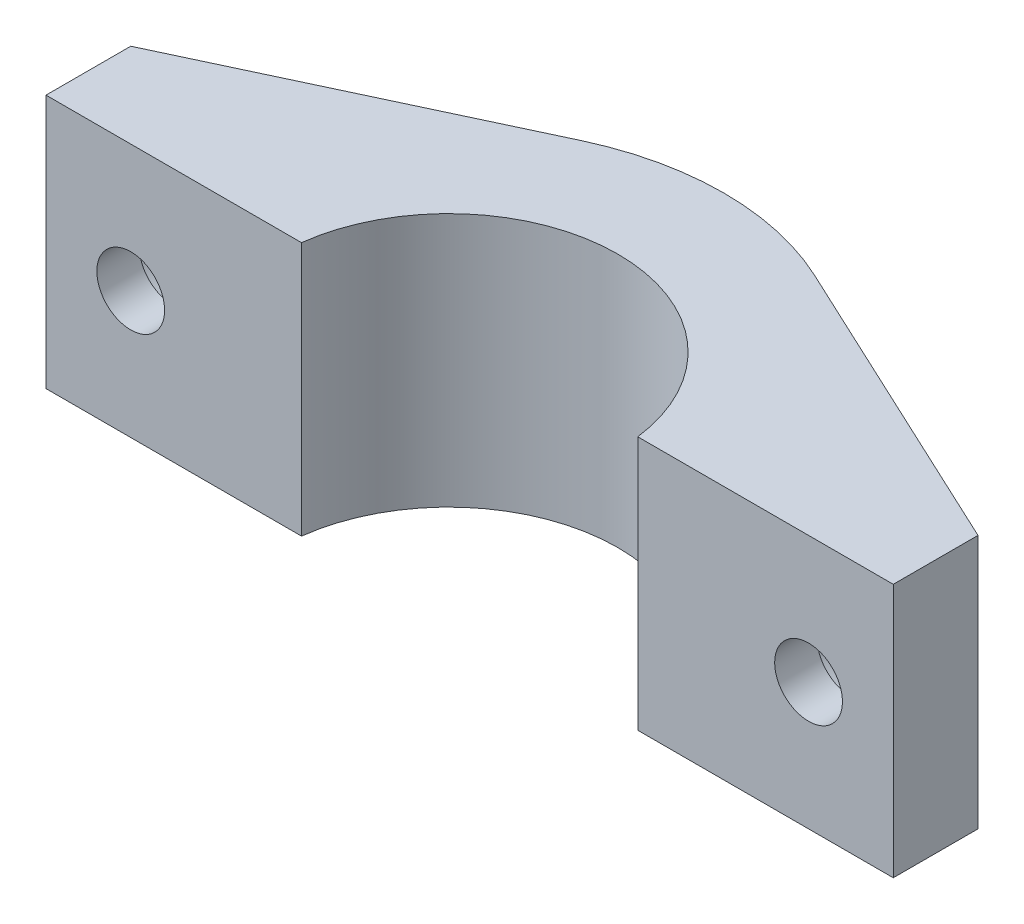
from build123d import *

# Parameters (mm, degrees)
BOSS_EXTRUDE1_DEPTH  = 12
SKETCH2_R            = 1.6
CUT_EXTRUDE1_DEPTH   = 12
SKETCH3_R            = 3
CUT_EXTRUDE2_DEPTH   = 2
BOSS_EXTRUDE2_DEPTH  = 2
MIRROR2_COPY_1_DEPTH = 2
SKETCH5_W            = 40
SKETCH5_H            = 1
CUT_EXTRUDE3_DEPTH   = 20


with BuildPart() as part:
    # Sketch1 → Boss-Extrude1 (new body)
    with BuildSketch(Plane(origin=(0, 0, 0), x_dir=(1, 0, 0), z_dir=(0, 1, 0))):
        with BuildLine():
            Line((13, 0), (20, 0))
            Line((20, 0), (20, 5))
            Line((20, 5), (12, 5))
            ThreePointArc((12, 5), (12.747548784, 2.549509757), (13, 0))
        make_face()
        with BuildLine():
            Line((8, 0), (13, 0))
            ThreePointArc((13, 0), (12.747548784, 2.549509757), (12, 5))
            Line((12, 5), (6.244997998, 5))
            ThreePointArc((6.244997998, 5), (7.548509256, 2.649529771), (8, 0))
        make_face()
        with BuildLine():
            ThreePointArc((-12, 5), (-12.747548784, 2.549509757), (-13, 0))
            Line((-13, 0), (-8, 0))
            ThreePointArc((-8, 0), (-7.548509256, 2.649529771), (-6.244997998, 5))
            Line((-6.244997998, 5), (-12, 5))
        make_face()
        with BuildLine():
            Line((6.244997998, 5), (12, 5))
            ThreePointArc((12, 5), (0, 13), (-12, 5))
            Line((-12, 5), (-6.244997998, 5))
            ThreePointArc((-6.244997998, 5), (0, 8), (6.244997998, 5))
        make_face()
        with BuildLine():
            Line((-20, 0), (-13, 0))
            ThreePointArc((-13, 0), (-12.747548784, 2.549509757), (-12, 5))
            Line((-12, 5), (-20, 5))
            Line((-20, 5), (-20, 0))
        make_face()
    extrude(amount=BOSS_EXTRUDE1_DEPTH)

    # Sketch2 → Cut-Extrude1 (cut)
    with BuildSketch(Plane(origin=(0, 0, -5), x_dir=(-1, 0, 0), z_dir=(0, 0, -1))):
        with Locations((16, 6)):
            Circle(SKETCH2_R)
        with Locations((-16, 6)):
            Circle(SKETCH2_R)
    extrude(amount=-CUT_EXTRUDE1_DEPTH, mode=Mode.SUBTRACT)

    # Sketch3 → Cut-Extrude2 (cut)
    with BuildSketch(Plane(origin=(0, 0, -5), x_dir=(-1, 0, 0), z_dir=(0, 0, -1))):
        with Locations((16, 6)):
            Circle(SKETCH3_R)
        with Locations((-16, 6)):
            Circle(SKETCH3_R)
    extrude(amount=-CUT_EXTRUDE2_DEPTH, mode=Mode.SUBTRACT)

    # Sketch4 → Boss-Extrude2 (add)
    with BuildSketch(Plane(origin=(0, 12, 0), x_dir=(1, 0, 0), z_dir=(0, 1, 0))):
        Polygon((-20, 5), (-5.505882353, 11.776470588), (-3.437353346, 7.352116879), (-12, 5), align=None)
    boss_extrude2 = extrude(amount=-BOSS_EXTRUDE2_DEPTH)

    # Mirror1: Boss-Extrude2 across plane
    add(boss_extrude2.mirror(Plane(origin=(0, 0, 0), x_dir=(0, 0, 1), z_dir=(1, 0, 0))))

    # Mirror2: Boss-Extrude2 across plane
    add(boss_extrude2.mirror(Plane.ZX.offset(6)))

    # Mirror2 copy 1 sketch → Mirror2 copy 1 (add)
    with BuildSketch(Plane(origin=(0, 0, 0), x_dir=(-1, 0, 0), z_dir=(0, -1, 0))):
        Polygon((-20, 5), (-5.505882353, 11.776470588), (-3.437353346, 7.352116879), (-12, 5), align=None)
    extrude(amount=-MIRROR2_COPY_1_DEPTH)

    # Chamfer1
    # the kernel refuses this chamfer: 5 mm, written as the material it adds along each edge
    with BuildSketch(Plane(origin=(-12, 2, -5), x_dir=(0.5282334615554308, 0, -0.8490991756521539), z_dir=(0, 1, 0))) as chamfer1_piece_1_section:
        with BuildLine():
            Line((3.55102746, 0), (-2.413771098, 3.712725473))
            Line((-2.413771098, 3.712725473), (-2.498681015, 3.659902127))
            ThreePointArc((-2.498681015, 3.659902127), (-1.254288539, 1.826872841), (-0.084909918, -0.052823346))
            Line((-0.084909918, -0.052823346), (0.016102351, -0.098695057))
            ThreePointArc((0.016102351, -0.098695057), (1.773886736, 0.065687387), (3.541120329, -0.099508034))
            Line((3.541120329, -0.099508034), (3.55102746, 0))
        make_face()
    chamfer1_piece_1 = extrude(amount=8, mode=Mode.PRIVATE)
    chamfer1_piece_1 = chamfer1_piece_1 - Plane(origin=(-16, 6, -6.086552006), x_dir=(-1, 0, 0), z_dir=(0, 0, -1)) * Cylinder(3, 31, mode=Mode.PRIVATE)
    add(chamfer1_piece_1)
    with BuildSketch(Plane(origin=(12, 2, -5), x_dir=(0.9998009840016291, 0, 0.01994974659924107), z_dir=(0, 1, 0))) as chamfer1_piece_2_section:
        with BuildLine():
            Line((4.428388121, 0), (-1.935550186, 2.977153255))
            Line((-1.935550186, 2.977153255), (-2.013576875, 2.914608585))
            ThreePointArc((-2.013576875, 2.914608585), (-0.911816487, 1.523016637), (-0.091522024, -0.040295399))
            Line((-0.091522024, -0.040295399), (0.001994975, -0.099980098))
            ThreePointArc((0.001994975, -0.099980098), (2.215307803, -0.055816279), (4.430383096, -0.099980098))
            Line((4.430383096, -0.099980098), (4.428388121, 0))
        make_face()
    chamfer1_piece_2 = extrude(amount=8, mode=Mode.PRIVATE)
    chamfer1_piece_2 = chamfer1_piece_2 - Plane(origin=(16, 6, -6.086550713), x_dir=(-1, 0, 0), z_dir=(0, 0, -1)) * Cylinder(3, 34, mode=Mode.PRIVATE)
    add(chamfer1_piece_2)

    # Sketch5 → Cut-Extrude3 (cut)
    with BuildSketch(Plane.XZ):
        with Locations((0, -0.5)):
            Rectangle(SKETCH5_W, SKETCH5_H)
    extrude(amount=-CUT_EXTRUDE3_DEPTH, mode=Mode.SUBTRACT)


solid = part.part
